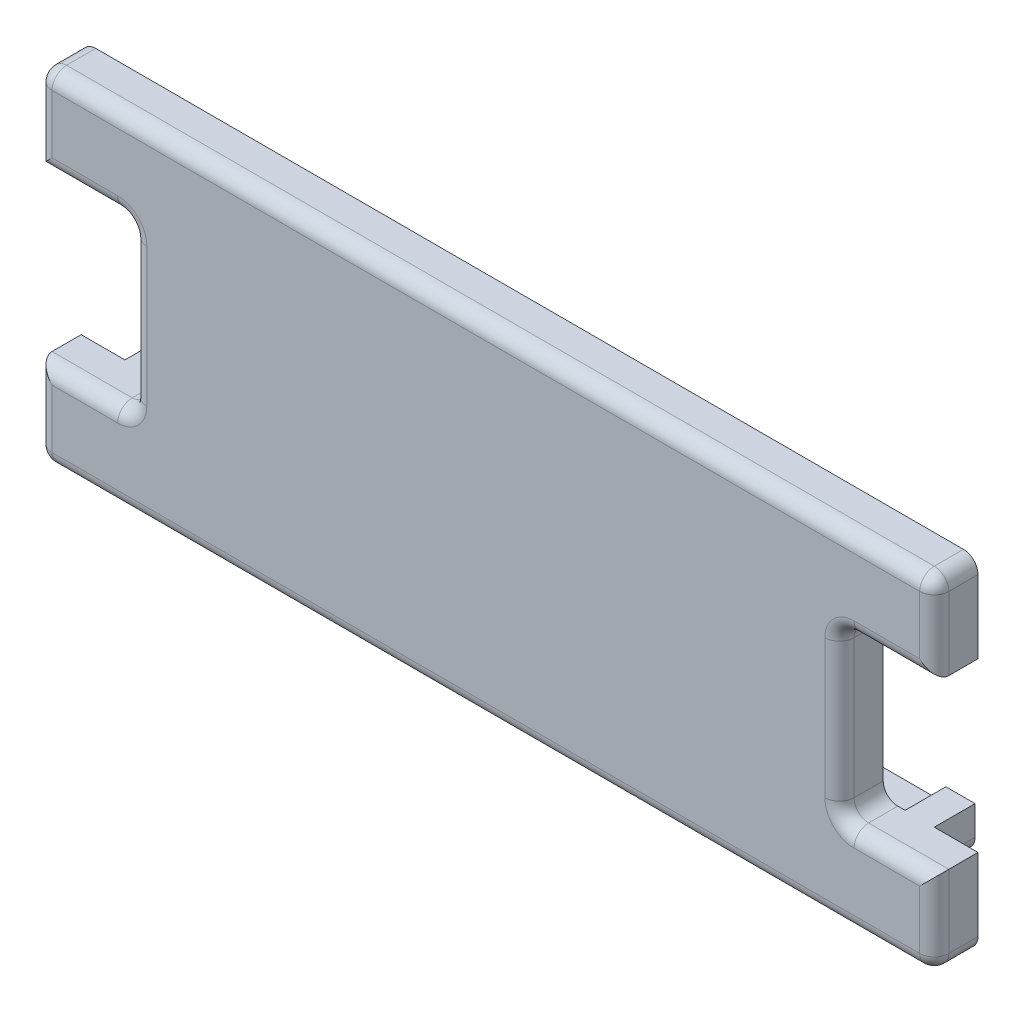
from build123d import *

# Parameters (mm, degrees)
BOSS_EXTRUDE2_DEPTH   = 2.8
BOSS_EXTRUDE2_2_DEPTH = 2.8
BOSS_EXTRUDE1_START   = 3
BOSS_EXTRUDE1_DEPTH   = 3
FILLET1_R             = 1


with BuildPart() as part:
    # Sketch3 → Boss-Extrude2 (new body)
    with BuildSketch(Plane.XY):
        with BuildLine():
            Line((25.75, 5.75), (27.75, 5.75))
            Line((27.75, 5.75), (27.75, 7.75))
            ThreePointArc((27.75, 7.75), (27.457106781, 8.457106781), (26.75, 8.75))
            Line((26.75, 8.75), (-26.75, 8.75))
            ThreePointArc((-26.75, 8.75), (-27.457106781, 8.457106781), (-27.75, 7.75))
            Line((-27.75, 7.75), (-27.75, 5.75))
            Line((-27.75, 5.75), (-25.75, 5.75))
            Line((-25.75, 5.75), (-25.75, 6.75))
            Line((-25.75, 6.75), (25.75, 6.75))
            Line((25.75, 6.75), (25.75, 5.75))
        make_face()
    extrude(amount=-BOSS_EXTRUDE2_DEPTH)



with BuildPart() as body_2:
    # Sketch3 → Boss-Extrude2 2 (new body)
    with BuildSketch(Plane.XY):
        with BuildLine():
            Line((-25.75, -6.75), (-25.75, -5.75))
            Line((-25.75, -5.75), (-27.75, -5.75))
            Line((-27.75, -5.75), (-27.75, -7.75))
            ThreePointArc((-27.75, -7.75), (-27.457106781, -8.457106781), (-26.75, -8.75))
            Line((-26.75, -8.75), (26.75, -8.75))
            ThreePointArc((26.75, -8.75), (27.457106781, -8.457106781), (27.75, -7.75))
            Line((27.75, -7.75), (27.75, -5.75))
            Line((27.75, -5.75), (25.75, -5.75))
            Line((25.75, -5.75), (25.75, -6.75))
            Line((25.75, -6.75), (-25.75, -6.75))
        make_face()
    extrude(amount=-BOSS_EXTRUDE2_2_DEPTH)


with BuildPart() as part_1:
    add(part.part)

    add(body_2.part)  # Boss-Extrude1 merges body 2
    # Sketch2 → Boss-Extrude1 (add)
    with BuildSketch(Plane.XY.offset(BOSS_EXTRUDE1_START)):
        with BuildLine():
            Line((24.25, 5.75), (27.75, 5.75))
            Line((27.75, 5.75), (27.75, 7.75))
            ThreePointArc((27.75, 7.75), (27.457106781, 8.457106781), (26.75, 8.75))
            Line((26.75, 8.75), (-26.75, 8.75))
            ThreePointArc((-26.75, 8.75), (-27.457106781, 8.457106781), (-27.75, 7.75))
            Line((-27.75, 7.75), (-27.75, 5.75))
            Line((-27.75, 5.75), (-24.25, 5.75))
            Line((-24.25, 5.75), (-24.25, -5.75))
            Line((-24.25, -5.75), (-27.75, -5.75))
            Line((-27.75, -5.75), (-27.75, -7.75))
            ThreePointArc((-27.75, -7.75), (-27.457106781, -8.457106781), (-26.75, -8.75))
            Line((-26.75, -8.75), (26.75, -8.75))
            ThreePointArc((26.75, -8.75), (27.457106781, -8.457106781), (27.75, -7.75))
            Line((27.75, -7.75), (27.75, -5.75))
            Line((27.75, -5.75), (24.25, -5.75))
            Line((24.25, -5.75), (24.25, 5.75))
        make_face()
        with BuildLine():
            ThreePointArc((30.75, 10.75), (30.457106781, 11.457106781), (29.75, 11.75))
            Line((29.75, 11.75), (-29.75, 11.75))
            ThreePointArc((-29.75, 11.75), (-30.457106781, 11.457106781), (-30.75, 10.75))
            Line((-30.75, 10.75), (-30.75, 5.75))
            Line((-30.75, 5.75), (-27.75, 5.75))
            Line((-27.75, 5.75), (-27.75, 7.75))
            ThreePointArc((-27.75, 7.75), (-27.457106781, 8.457106781), (-26.75, 8.75))
            Line((-26.75, 8.75), (26.75, 8.75))
            ThreePointArc((26.75, 8.75), (27.457106781, 8.457106781), (27.75, 7.75))
            Line((27.75, 7.75), (27.75, 5.75))
            Line((27.75, 5.75), (30.75, 5.75))
            Line((30.75, 5.75), (30.75, 10.75))
        make_face()
        with BuildLine():
            Line((-30.75, -5.75), (-30.75, -10.75))
            ThreePointArc((-30.75, -10.75), (-30.457106781, -11.457106781), (-29.75, -11.75))
            Line((-29.75, -11.75), (29.75, -11.75))
            ThreePointArc((29.75, -11.75), (30.457106781, -11.457106781), (30.75, -10.75))
            Line((30.75, -10.75), (30.75, -5.75))
            Line((30.75, -5.75), (27.75, -5.75))
            Line((27.75, -5.75), (27.75, -7.75))
            ThreePointArc((27.75, -7.75), (27.457106781, -8.457106781), (26.75, -8.75))
            Line((26.75, -8.75), (-26.75, -8.75))
            ThreePointArc((-26.75, -8.75), (-27.457106781, -8.457106781), (-27.75, -7.75))
            Line((-27.75, -7.75), (-27.75, -5.75))
            Line((-27.75, -5.75), (-30.75, -5.75))
        make_face()
    extrude(amount=-BOSS_EXTRUDE1_DEPTH)

    # Fillet1
    fillet1_edges = [part_1.edges().sort_by_distance(p)[0] for p in [
        (24.25, -5.75, 1.5),
        (24.25, 5.75, 1.5),
        (-24.25, -5.75, 1.5),
        (-24.25, 5.75, 1.5),
        (-24.25, 0, 3),
        (-27.5, 5.75, 3),
        (-30.75, 8.25, 3),
        (-30.457106781, 11.457106781, 3),
        (0, 11.75, 3),
        (30.457106781, 11.457106781, 3),
        (30.75, 8.25, 3),
        (27.5, 5.75, 3),
        (24.25, 0, 3),
        (27.5, -5.75, 3),
        (30.75, -8.25, 3),
        (30.457106781, -11.457106781, 3),
        (0, -11.75, 3),
        (-30.457106781, -11.457106781, 3),
        (-30.75, -8.25, 3),
        (-27.5, -5.75, 3),
        (0, 6.75, 0),
        (0, -6.75, 0),
    ]]
    fillet(fillet1_edges, radius=FILLET1_R - 0.0001)  # a hair under: the kernel refuses the full size


solid = part_1.part
